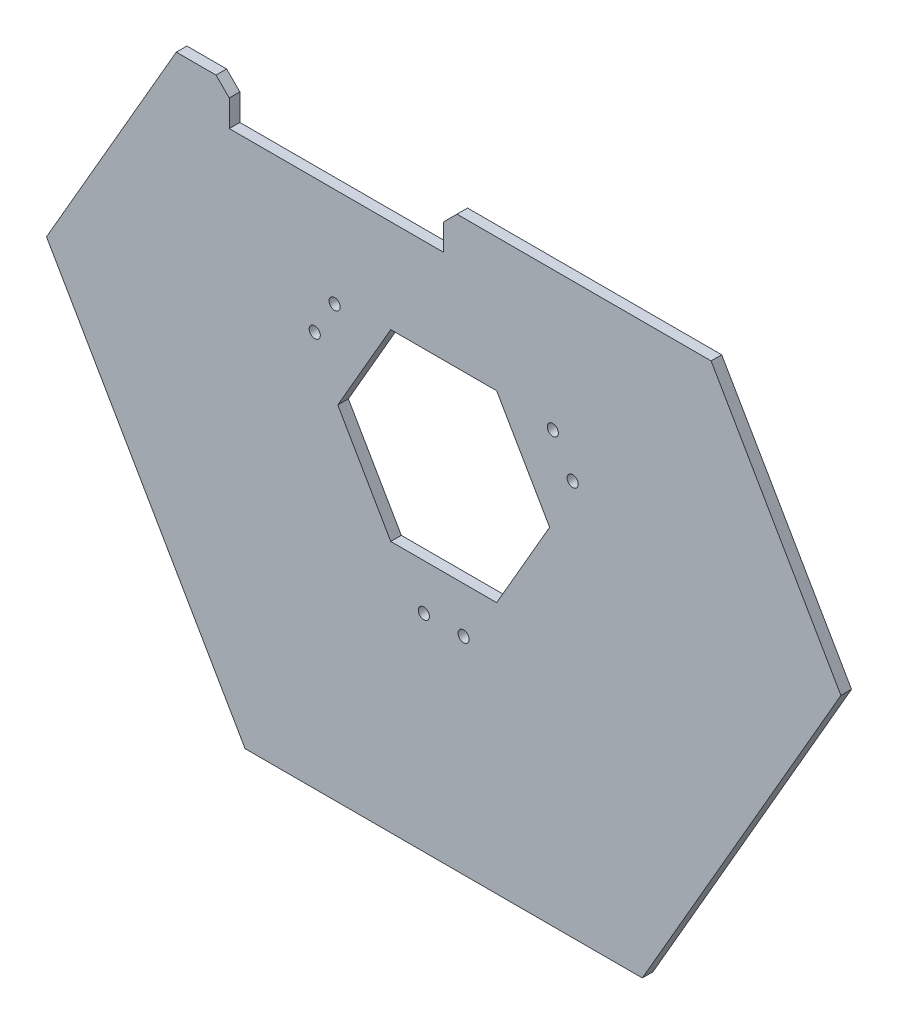
from build123d import *

# Parameters (mm, degrees)
EXTRUDE_1_DEPTH          = 4
CUT_EXTRUDE_1_REACH      = 200.472
SKETCH_2_R               = 2.1
CUT_EXTRUDE_2_DEPTH      = 199.471660446
CUT_EXTRUDE_2_DEPTH_BACK = 4
CUT_EXTRUDE_3_REACH      = 200.472
PATTERN_CIRCULAR_1_COUNT = 3
CHAMFER_1_SIZE           = 5


with BuildPart() as part:
    # 草圖1 → 填料-伸長1 (new body)
    with BuildSketch(Plane.XY):
        Polygon((150, 0), (75, 129.903810568), (-75, 129.903810568), (-150, 0), (-75, -129.903810568), (75, -129.903810568), align=None)
    extrude(amount=EXTRUDE_1_DEPTH)

    # 草圖2 → 除料-伸長1 (cut, up to next)
    with BuildSketch(Plane.XY.offset(4), mode=Mode.PRIVATE) as cut_extrude_1_sk1:
        with Locations((-7.5, -51.903810568)):
            Circle(SKETCH_2_R)
    cut_extrude_1_tool1 = extrude(cut_extrude_1_sk1.sketch, amount=-CUT_EXTRUDE_1_REACH, mode=Mode.PRIVATE) & part.part
    # 草圖2 → 除料-伸長1 (cut, up to next)
    with BuildSketch(Plane.XY.offset(4), mode=Mode.PRIVATE) as cut_extrude_1_sk2:
        with Locations((7.5, -51.903810568)):
            Circle(SKETCH_2_R)
    cut_extrude_1_tool2 = extrude(cut_extrude_1_sk2.sketch, amount=-CUT_EXTRUDE_1_REACH, mode=Mode.PRIVATE) & part.part
    cut_extrude_1_1 = cut_extrude_1_tool1.solids().sort_by_distance((-7.5, -51.903811, 4))[0]
    add(cut_extrude_1_1, mode=Mode.SUBTRACT)
    cut_extrude_1_2 = cut_extrude_1_tool2.solids().sort_by_distance((7.5, -51.903811, 4))[0]
    add(cut_extrude_1_2, mode=Mode.SUBTRACT)
    cut_extrude_1 = cut_extrude_1_1 + cut_extrude_1_2  # 除料-伸長1 as one shape, for the pattern or mirror that repeats it

    # 草圖3 → 除料-伸長2 (cut, two sides: drawn at the far end of the back side and taken through both)
    with BuildSketch(Plane.XY.offset(4).offset(-CUT_EXTRUDE_2_DEPTH_BACK)):
        Polygon((-771.688434383, 84.903810568), (-100.980762114, 84.903810568), (-80.980762114, 84.903810568), (-80.980762114, 69.903810568), (0, 69.903810568), (0, 84.903810568), (100.980762114, 84.903810568), (771.688434383, 84.903810568), (771.688434383, 1426.319155106), (-771.688434383, 1426.319155106), align=None)
    extrude(amount=CUT_EXTRUDE_2_DEPTH + CUT_EXTRUDE_2_DEPTH_BACK, mode=Mode.SUBTRACT)

    # 草圖4 → 除料-伸長3 (cut, up to next)
    with BuildSketch(Plane.XY.offset(4), mode=Mode.PRIVATE) as cut_extrude_3_sk1:
        Polygon((40, 0), (20, 34.641016151), (-20, 34.641016151), (-40, 0), (-20, -34.641016151), (20, -34.641016151), align=None)
    cut_extrude_3_tool1 = extrude(cut_extrude_3_sk1.sketch, amount=-CUT_EXTRUDE_3_REACH, mode=Mode.PRIVATE) & part.part
    add(cut_extrude_3_tool1.solids().sort_by_distance((0, 0, 4))[0], mode=Mode.SUBTRACT)

    # 環狀複製排列1: 除料-伸長1 ×3 about axis
    pattern_circular_1_axis = Axis((0, 0, 0), (0, 0, 1))
    for i in range(1, PATTERN_CIRCULAR_1_COUNT):
        add(cut_extrude_1.rotate(pattern_circular_1_axis, i * 360 / PATTERN_CIRCULAR_1_COUNT), mode=Mode.SUBTRACT)

    # 導角1
    chamfer_1_edges = [part.edges().sort_by_distance(p)[0] for p in [
        (0, 84.903810568, 2),
        (-80.980762114, 84.903810568, 2),
    ]]
    chamfer(chamfer_1_edges, length=CHAMFER_1_SIZE)


solid = part.part
